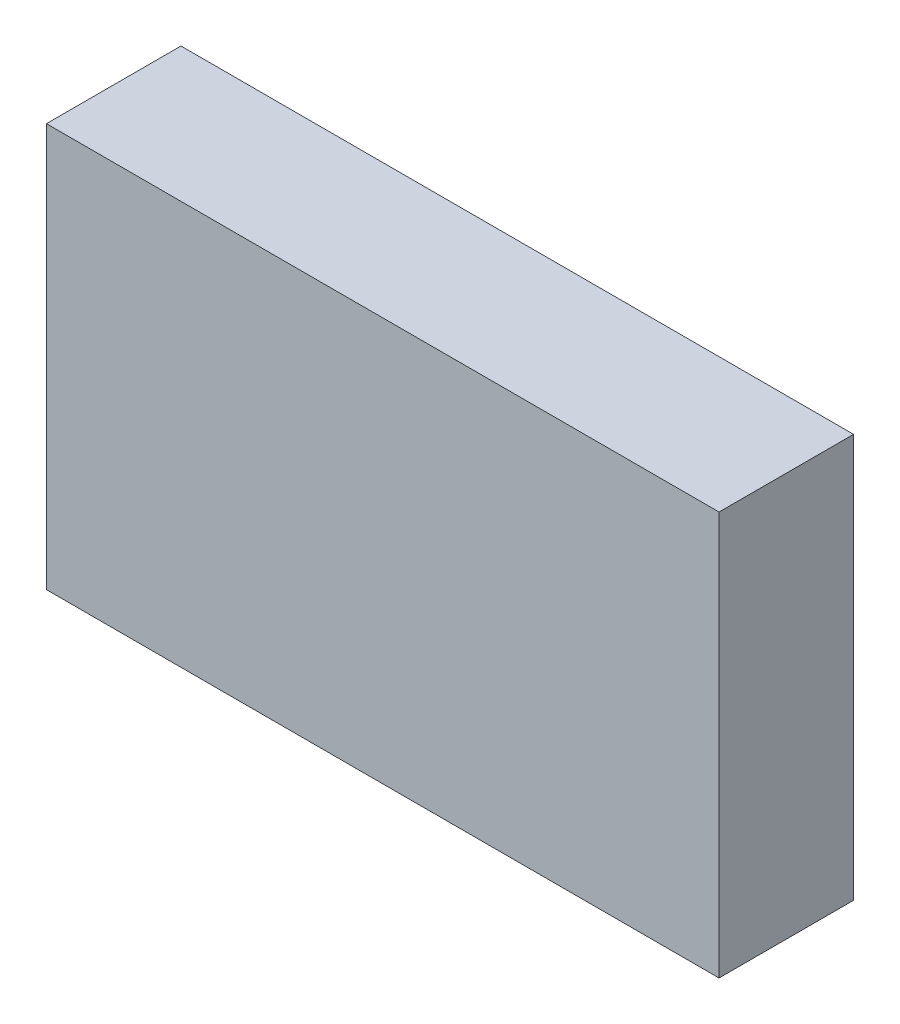
from build123d import *

# Parameters (mm, degrees)
SKETCH1_W           = 10
SKETCH1_H           = 6
BOSS_EXTRUDE1_DEPTH = 2
SKETCH2_R           = 2.5
CUT_EXTRUDE1_DEPTH  = 1


with BuildPart() as part:
    # Sketch1 → Boss-Extrude1 (new body)
    with BuildSketch(Plane.XY):
        with Locations((5, 3)):
            Rectangle(SKETCH1_W, SKETCH1_H)
    extrude(amount=BOSS_EXTRUDE1_DEPTH)

    # Sketch2 → Cut-Extrude1 (cut)
    with BuildSketch(Plane(origin=(0, 0, 0), x_dir=(-1, 0, 0), z_dir=(0, 0, -1))):
        with Locations((-5, 3)):
            Circle(SKETCH2_R)
    extrude(amount=-CUT_EXTRUDE1_DEPTH, mode=Mode.SUBTRACT)


solid = part.part
